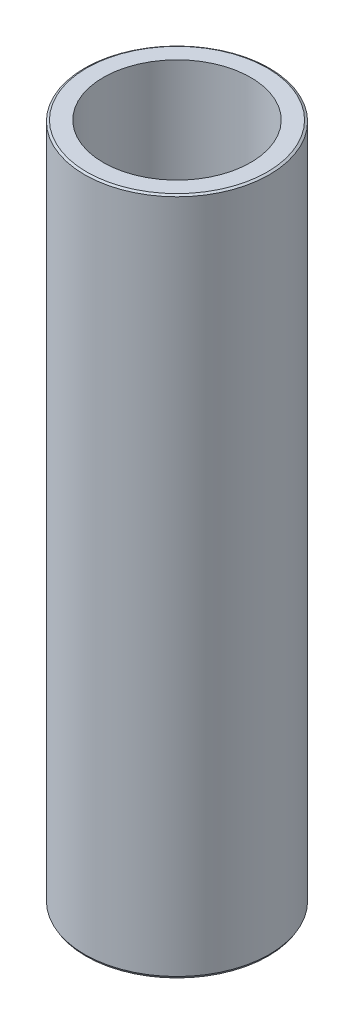
from build123d import *
from OCP.BRepFilletAPI import BRepFilletAPI_MakeChamfer

# Parameters (mm, degrees)
SKETCH1_R           = 50
BOSS_EXTRUDE1_DEPTH = 367.390058799
SKETCH2_R           = 39.912027488
CUT_EXTRUDE1_DEPTH  = 375.132938011
CHAMFER1_SIZE       = 0.672164671
CHAMFER1_SIZE2      = 1.164223361


with BuildPart() as part:
    # Sketch1 → Boss-Extrude1 (new body)
    with BuildSketch(Plane(origin=(0, 0, 0), x_dir=(1, 0, 0), z_dir=(0, 1, 0))):
        Circle(SKETCH1_R)
    extrude(amount=BOSS_EXTRUDE1_DEPTH)

    # Sketch2 → Cut-Extrude1 (cut, through all)
    with BuildSketch(Plane(origin=(0, 0, 0), x_dir=(1, 0, 0), z_dir=(0, 1, 0))):
        Circle(SKETCH2_R)
    extrude(amount=CUT_EXTRUDE1_DEPTH, mode=Mode.SUBTRACT)

    # Chamfer1: one chamfer whose edges measure the first distance from different faces: ONE call of the kernel's chamfer builder (chamfer() names one face for all edges)
    chamfer1_edges_1 = [part.edges().sort_by_distance(p)[0] for p in [
        (-50, 367.390058799, 0),
    ]]
    chamfer1_side_1 = [part.faces().sort_by_distance(p)[0] for p in [
        (-50, 183.6950294, 0),
    ]]
    chamfer1_edges_2 = [part.edges().sort_by_distance(p)[0] for p in [
        (-50, 0, 0),
    ]]
    chamfer1_side_2 = [part.faces().sort_by_distance(p)[0] for p in [
        (-48.585786438, 0, 0),
    ]]
    chamfer1 = BRepFilletAPI_MakeChamfer(part.part.solid().wrapped)
    for e in chamfer1_edges_1:
        chamfer1.Add(CHAMFER1_SIZE, CHAMFER1_SIZE2, e.wrapped, chamfer1_side_1[0].wrapped)  # the first distance lies on this face
    for e in chamfer1_edges_2:
        chamfer1.Add(CHAMFER1_SIZE, CHAMFER1_SIZE2, e.wrapped, chamfer1_side_2[0].wrapped)  # the first distance lies on this face
    add(Compound.cast(chamfer1.Shape()), mode=Mode.REPLACE)


solid = part.part
